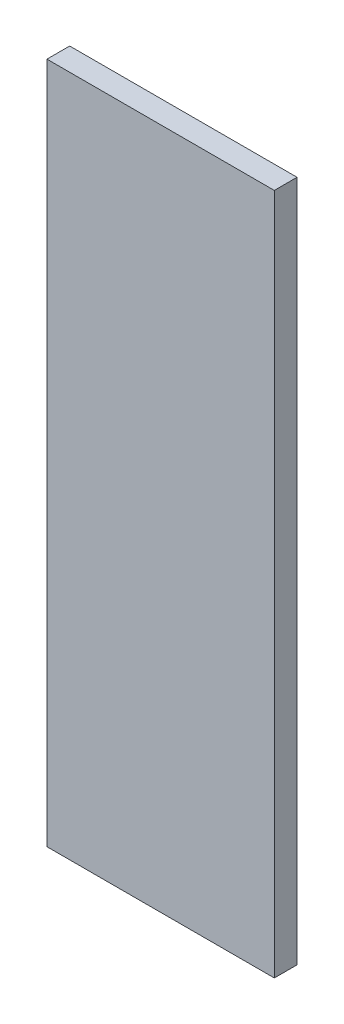
from build123d import *

# Parameters (mm, degrees)
SKETCH1_W           = 100
SKETCH1_H           = 300
BOSS_EXTRUDE1_DEPTH = 10


with BuildPart() as part:
    # Sketch1 → Boss-Extrude1 (new body)
    with BuildSketch(Plane.XY):
        Rectangle(SKETCH1_W, SKETCH1_H)
    extrude(amount=BOSS_EXTRUDE1_DEPTH)


solid = part.part
